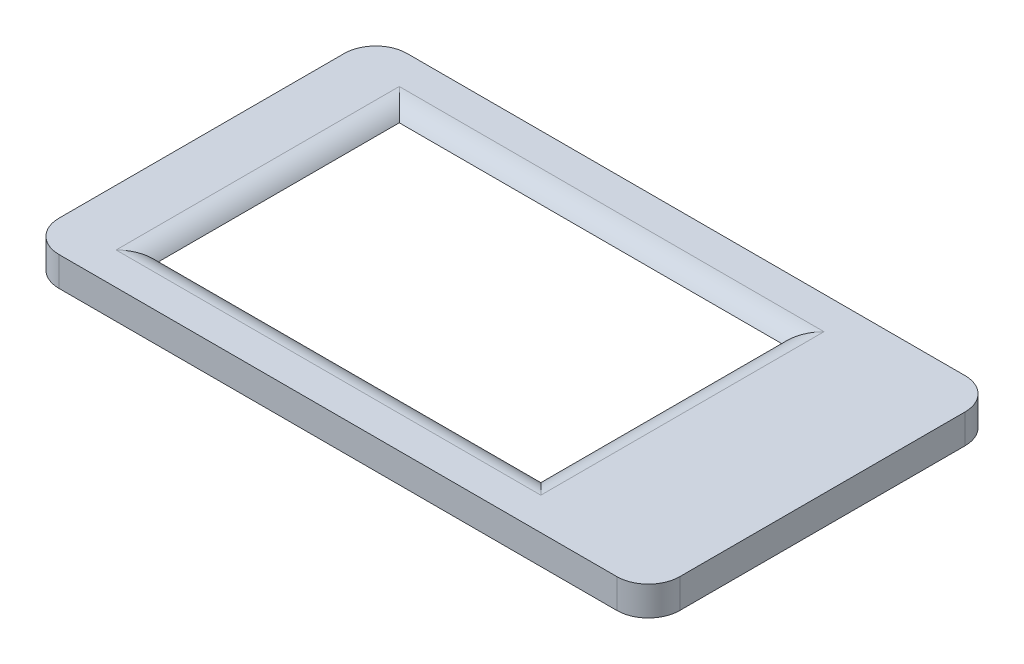
from build123d import *

# Parameters (mm, degrees)
SKETCH_1_W            = 118.4
SKETCH_1_H            = 66.4
EXTRUDE_1_DEPTH       = 5.6
SKETCH_5_R            = 3
CUT_EXTRUDE_961_DEPTH = 3
SKETCH_7_W            = 85
SKETCH_7_H            = 58
LCD_DEPTH             = 3.6
SKETCH_13_W           = 73
SKETCH_13_H           = 46
CUT_EXTRUDE_1_DEPTH   = 10
FILLET_2_R            = 5
FILLET_3_R            = 6


with BuildPart() as part:
    # Эскиз1 → Бобышка-Вытянуть1 (new body)
    with BuildSketch(Plane(origin=(0, 0, 0), x_dir=(1, 0, 0), z_dir=(0, 1, 0))):
        with Locations((-2, 0)):
            Rectangle(SKETCH_1_W, SKETCH_1_H)
    extrude(amount=EXTRUDE_1_DEPTH)

    # Эскиз5 → Cut-Extrude 961 (cut)
    with BuildSketch(Plane.XZ):
        with Locations(Location((-56.16, 21.1, 0), (0, 0, 270))):
            Circle(SKETCH_5_R)
        with Locations(Location((-56.16, -21.9, 0), (0, 0, 90))):
            Circle(SKETCH_5_R)
        with Locations(Location((35.96, 22.3, 0), (0, 0, 270))):
            Circle(SKETCH_5_R)
        with Locations(Location((35.96, -18.7, 0), (0, 0, 90))):
            Circle(SKETCH_5_R)
    extrude(amount=-CUT_EXTRUDE_961_DEPTH, mode=Mode.SUBTRACT)

    # Эскиз7 → под LCD (cut)
    with BuildSketch(Plane.XZ):
        with Locations((-10, 0)):
            Rectangle(SKETCH_7_W, SKETCH_7_H)
    extrude(amount=-LCD_DEPTH, mode=Mode.SUBTRACT)

    # Эскиз13 → Вырез-Вытянуть1 (cut)
    with BuildSketch(Plane.XZ.offset(-3.6)):
        with Locations((-10, 0)):
            Rectangle(SKETCH_13_W, SKETCH_13_H)
    extrude(amount=-CUT_EXTRUDE_1_DEPTH, mode=Mode.SUBTRACT)

    # Скругление2
    # the kernel refuses this fillet: 5 mm, written as the material it takes off along each edge
    with BuildSketch(Plane(origin=(-46.5, 5.6, -23), x_dir=(-1, 0, 0), z_dir=(0, 0, 1)), Plane(origin=(26.5, 5.6, 23), x_dir=(1, 0, 0), z_dir=(0, 0, -1))) as fillet_2_piece_1:
        with BuildLine():
            CenterArc((4, 5), FILLET_2_R, 216.869897646, 53.130102354)
            Line((0, 2), (-0.08, 1.94))
            ThreePointArc((-0.08, 1.94), (-0.1, 1), (-0.1, 0))
            Line((-0.1, 0), (0, -0.1))
            Line((0, -0.1), (4, -0.1))
            Line((4, -0.1), (4, 0))
        make_face()
    extrude(amount=46, mode=Mode.SUBTRACT)
    with BuildSketch(Plane(origin=(-46.5, 5.6, 23), x_dir=(0, 0, 1), z_dir=(1, 0, 0)), Plane(origin=(26.5, 5.6, -23), x_dir=(0, 0, -1), z_dir=(-1, 0, 0))) as fillet_2_piece_2:
        with BuildLine():
            CenterArc((4, 5), FILLET_2_R, 216.869897646, 53.130102354)
            Line((0, 2), (-0.08, 1.94))
            ThreePointArc((-0.08, 1.94), (-0.1, 1), (-0.1, 0))
            Line((-0.1, 0), (0, -0.1))
            Line((0, -0.1), (4, -0.1))
            Line((4, -0.1), (4, 0))
        make_face()
    extrude(amount=73, mode=Mode.SUBTRACT)
    with BuildSketch(Plane(origin=(-46.5, 5.6, -33), x_dir=(-1, 0, 0), z_dir=(0, 0, 1))) as fillet_2_piece_3a_section:
        with BuildLine():
            CenterArc((4, 5), FILLET_2_R, 216.869897646, 53.130102354)
            Line((0, 2), (-0.08, 1.94))
            ThreePointArc((-0.08, 1.94), (-0.1, 1), (-0.1, 0))
            Line((-0.1, 0), (0, -0.1))
            Line((0, -0.1), (4, -0.1))
            Line((4, -0.1), (4, 0))
        make_face()
    fillet_2_piece_3a = extrude(amount=56, mode=Mode.PRIVATE)
    fillet_2_piece_3a = split(fillet_2_piece_3a, bisect_by=Plane(origin=(-47.529417057, 5.088057438, -23), z_dir=(0, 0, -1)), keep=Keep.TOP, mode=Mode.PRIVATE)
    with BuildSketch(Plane(origin=(26.5, 5.6, -23), x_dir=(0, 0, -1), z_dir=(-1, 0, 0))) as fillet_2_piece_3b_section:
        with BuildLine():
            CenterArc((4, 5), FILLET_2_R, 216.869897646, 53.130102354)
            Line((0, 2), (-0.08, 1.94))
            ThreePointArc((-0.08, 1.94), (-0.1, 1), (-0.1, 0))
            Line((-0.1, 0), (0, -0.1))
            Line((0, -0.1), (4, -0.1))
            Line((4, -0.1), (4, 0))
        make_face()
    fillet_2_piece_3b = extrude(amount=83, mode=Mode.PRIVATE)
    fillet_2_piece_3b = split(fillet_2_piece_3b, bisect_by=Plane(origin=(-46.5, 5.088057438, -24.029417057), z_dir=(-1, 0, 0)), keep=Keep.TOP, mode=Mode.PRIVATE)
    fillet_2_piece_3 = fillet_2_piece_3a & fillet_2_piece_3b
    add(fillet_2_piece_3, mode=Mode.SUBTRACT)
    with BuildSketch(Plane(origin=(-46.5, 5.6, -23), x_dir=(-1, 0, 0), z_dir=(0, 0, 1))) as fillet_2_piece_4a_section:
        with BuildLine():
            CenterArc((4, 5), FILLET_2_R, 216.869897646, 53.130102354)
            Line((0, 2), (-0.08, 1.94))
            ThreePointArc((-0.08, 1.94), (-0.1, 1), (-0.1, 0))
            Line((-0.1, 0), (0, -0.1))
            Line((0, -0.1), (4, -0.1))
            Line((4, -0.1), (4, 0))
        make_face()
    fillet_2_piece_4a = extrude(amount=56, mode=Mode.PRIVATE)
    fillet_2_piece_4a = split(fillet_2_piece_4a, bisect_by=Plane(origin=(-47.529417057, 5.088057438, 23), z_dir=(0, 0, 1)), keep=Keep.TOP, mode=Mode.PRIVATE)
    with BuildSketch(Plane(origin=(-56.5, 5.6, 23), x_dir=(0, 0, 1), z_dir=(1, 0, 0))) as fillet_2_piece_4b_section:
        with BuildLine():
            CenterArc((4, 5), FILLET_2_R, 216.869897646, 53.130102354)
            Line((0, 2), (-0.08, 1.94))
            ThreePointArc((-0.08, 1.94), (-0.1, 1), (-0.1, 0))
            Line((-0.1, 0), (0, -0.1))
            Line((0, -0.1), (4, -0.1))
            Line((4, -0.1), (4, 0))
        make_face()
    fillet_2_piece_4b = extrude(amount=83, mode=Mode.PRIVATE)
    fillet_2_piece_4b = split(fillet_2_piece_4b, bisect_by=Plane(origin=(-46.5, 5.088057438, 24.029417057), z_dir=(-1, 0, 0)), keep=Keep.TOP, mode=Mode.PRIVATE)
    fillet_2_piece_4 = fillet_2_piece_4a & fillet_2_piece_4b
    add(fillet_2_piece_4, mode=Mode.SUBTRACT)
    with BuildSketch(Plane(origin=(26.5, 5.6, 33), x_dir=(1, 0, 0), z_dir=(0, 0, -1))) as fillet_2_piece_5a_section:
        with BuildLine():
            CenterArc((4, 5), FILLET_2_R, 216.869897646, 53.130102354)
            Line((0, 2), (-0.08, 1.94))
            ThreePointArc((-0.08, 1.94), (-0.1, 1), (-0.1, 0))
            Line((-0.1, 0), (0, -0.1))
            Line((0, -0.1), (4, -0.1))
            Line((4, -0.1), (4, 0))
        make_face()
    fillet_2_piece_5a = extrude(amount=56, mode=Mode.PRIVATE)
    fillet_2_piece_5a = split(fillet_2_piece_5a, bisect_by=Plane(origin=(27.529417057, 5.088057438, 23), z_dir=(0, 0, 1)), keep=Keep.TOP, mode=Mode.PRIVATE)
    with BuildSketch(Plane(origin=(-46.5, 5.6, 23), x_dir=(0, 0, 1), z_dir=(1, 0, 0))) as fillet_2_piece_5b_section:
        with BuildLine():
            CenterArc((4, 5), FILLET_2_R, 216.869897646, 53.130102354)
            Line((0, 2), (-0.08, 1.94))
            ThreePointArc((-0.08, 1.94), (-0.1, 1), (-0.1, 0))
            Line((-0.1, 0), (0, -0.1))
            Line((0, -0.1), (4, -0.1))
            Line((4, -0.1), (4, 0))
        make_face()
    fillet_2_piece_5b = extrude(amount=83, mode=Mode.PRIVATE)
    fillet_2_piece_5b = split(fillet_2_piece_5b, bisect_by=Plane(origin=(26.5, 5.088057438, 24.029417057), z_dir=(1, 0, 0)), keep=Keep.TOP, mode=Mode.PRIVATE)
    fillet_2_piece_5 = fillet_2_piece_5a & fillet_2_piece_5b
    add(fillet_2_piece_5, mode=Mode.SUBTRACT)
    with BuildSketch(Plane(origin=(36.5, 5.6, -23), x_dir=(0, 0, -1), z_dir=(-1, 0, 0))) as fillet_2_piece_6a_section:
        with BuildLine():
            CenterArc((4, 5), FILLET_2_R, 216.869897646, 53.130102354)
            Line((0, 2), (-0.08, 1.94))
            ThreePointArc((-0.08, 1.94), (-0.1, 1), (-0.1, 0))
            Line((-0.1, 0), (0, -0.1))
            Line((0, -0.1), (4, -0.1))
            Line((4, -0.1), (4, 0))
        make_face()
    fillet_2_piece_6a = extrude(amount=83, mode=Mode.PRIVATE)
    fillet_2_piece_6a = split(fillet_2_piece_6a, bisect_by=Plane(origin=(26.5, 5.088057438, -24.029417057), z_dir=(1, 0, 0)), keep=Keep.TOP, mode=Mode.PRIVATE)
    with BuildSketch(Plane(origin=(26.5, 5.6, 23), x_dir=(1, 0, 0), z_dir=(0, 0, -1))) as fillet_2_piece_6b_section:
        with BuildLine():
            CenterArc((4, 5), FILLET_2_R, 216.869897646, 53.130102354)
            Line((0, 2), (-0.08, 1.94))
            ThreePointArc((-0.08, 1.94), (-0.1, 1), (-0.1, 0))
            Line((-0.1, 0), (0, -0.1))
            Line((0, -0.1), (4, -0.1))
            Line((4, -0.1), (4, 0))
        make_face()
    fillet_2_piece_6b = extrude(amount=56, mode=Mode.PRIVATE)
    fillet_2_piece_6b = split(fillet_2_piece_6b, bisect_by=Plane(origin=(27.529417057, 5.088057438, -23), z_dir=(0, 0, -1)), keep=Keep.TOP, mode=Mode.PRIVATE)
    fillet_2_piece_6 = fillet_2_piece_6a & fillet_2_piece_6b
    add(fillet_2_piece_6, mode=Mode.SUBTRACT)

    # Скругление3
    fillet_3_edges = [part.edges().sort_by_distance(p)[0] for p in [
        (-61.2, 2.8, -33.2),
        (57.2, 2.8, -33.2),
        (57.2, 2.8, 33.2),
        (-61.2, 2.8, 33.2),
    ]]
    fillet(fillet_3_edges, radius=FILLET_3_R)


solid = part.part
